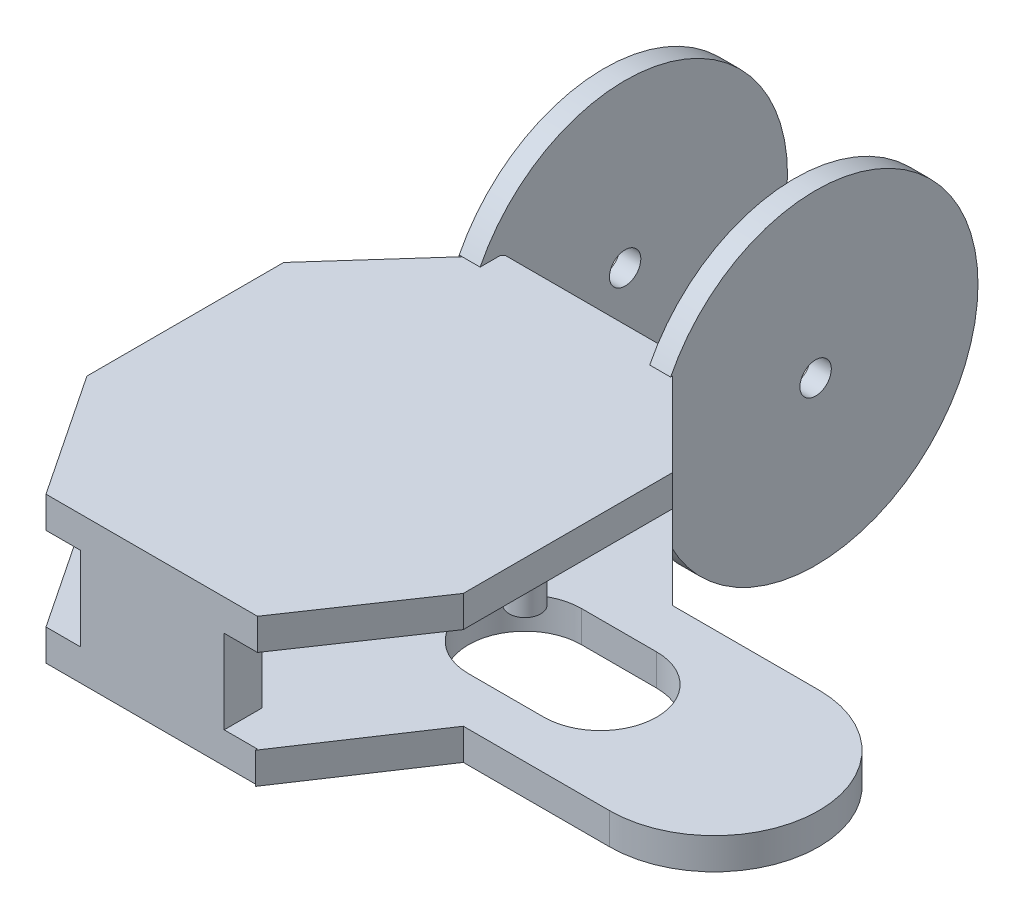
from build123d import *

# Parameters (mm, degrees)
SKETCH1_R            = 1.5
BOSS_EXTRUDE1_DEPTH  = 3
FILLET5_RADIUS       = 10
FILLET5_LENGTH       = 3
FILLET2_R            = 5.4
FILLET4_R            = 5.4
SKETCH2_W            = 20.222728951
SKETCH2_H            = 4.462372077
CUT_EXTRUDE1_DEPTH   = 6
BOSS_EXTRUDE2_START  = 8
BOSS_EXTRUDE2_DEPTH  = 3
SKETCH4_W            = 16.22017041
SKETCH4_H            = 2.049534957
SKETCH4_W_2          = 13.728839959
SKETCH4_H_2          = 3.633925055
BOSS_EXTRUDE3_DEPTH  = 8
BOSS_EXTRUDE4_START  = -8
SKETCH5_R            = 1.5
BOSS_EXTRUDE4_DEPTH  = 8
SKETCH6_R            = 1.5
BOSS_EXTRUDE5_DEPTH  = 8
BOSS_EXTRUDE9_DEPTH  = 2
BOSS_EXTRUDE10_START = 2
SKETCH10_W           = 2.049534957
SKETCH10_H           = 8
BOSS_EXTRUDE10_DEPTH = 2
SKETCH11_R           = 1.5
CUT_EXTRUDE2_DEPTH   = 21


with BuildPart() as part:
    # Sketch1 → Boss-Extrude1 (new body)
    # profile 1 of 2: a face of its own
    with BuildSketch(Plane(origin=(0, 0, 0), x_dir=(1, 0, 0), z_dir=(0, 1, 0))):
        with BuildLine():
            Line((3.5, 25), (0, 25))
            Line((0, 25), (0, 15))
            Line((0, 15), (10, 0))
            Line((10, 0), (26, 0))
            Line((26, 0), (36, 15))
            Line((36, 15), (60, 15))
            Line((60, 15), (60, 25))
            Line((60, 25), (44.5, 25))
            Line((44.5, 25), (44.5, 19.6))
            Line((44.5, 19.6), (26.5, 19.6))
            Line((26.5, 19.6), (26.5, 25))
            Line((26.5, 25), (6.5, 25))
            ThreePointArc((6.5, 25), (5, 23.5), (3.5, 25))
        make_face()
        with Locations(Location((13, 5, 0), (0, 0, 270))):
            Circle(SKETCH1_R, mode=Mode.SUBTRACT)
        with Locations(Location((23, 5, 0), (0, 0, 270))):
            Circle(SKETCH1_R, mode=Mode.SUBTRACT)
    # profile 2 of 2: a face of its own
    with BuildSketch(Plane(origin=(0, 0, 0), x_dir=(1, 0, 0), z_dir=(0, 1, 0))):
        with BuildLine():
            Line((10, 45), (0, 33.819660113))
            Line((0, 33.819660113), (0, 25))
            Line((0, 25), (3.5, 25))
            ThreePointArc((3.5, 25), (5, 26.5), (6.5, 25))
            Line((6.5, 25), (26.5, 25))
            Line((26.5, 25), (26.5, 30.4))
            Line((26.5, 30.4), (44.5, 30.4))
            Line((44.5, 30.4), (44.5, 25))
            Line((44.5, 25), (60, 25))
            Line((60, 25), (60, 35))
            Line((60, 35), (36, 35))
            Line((36, 35), (26, 45))
            Line((26, 45), (10, 45))
        make_face()
    extrude(amount=BOSS_EXTRUDE1_DEPTH)

    # Fillet5: full round fillet: the end face becomes a half cylinder, R = half its width
    fillet5_face = Plane((60, 1.5, -25), x_dir=(0, -1, 0), z_dir=(1, 0, 0))  # on the end face: x along it, z out of the body
    fillet5_slab = fillet5_face.offset(-FILLET5_RADIUS / 2) * Box(FILLET5_LENGTH, 2 * FILLET5_RADIUS, FILLET5_RADIUS, mode=Mode.PRIVATE)  # the body's end, R deep
    fillet5_round = Plane((50, 1.5, -25), x_dir=(1, 0, 0), z_dir=(0, -1, 0)) * Cylinder(FILLET5_RADIUS, FILLET5_LENGTH, mode=Mode.PRIVATE)  # its axis R under the face
    add(fillet5_slab - fillet5_round, mode=Mode.SUBTRACT)

    # Fillet2
    fillet2_edges = [part.edges().sort_by_distance(p)[0] for p in [
        (26.5, 1.5, -30.4),
        (26.5, 1.5, -19.6),
    ]]
    fillet(fillet2_edges, radius=FILLET2_R - 0.0001)  # a hair under: the kernel refuses the full size

    # Fillet4
    fillet4_edges = [part.edges().sort_by_distance(p)[0] for p in [
        (44.5, 1.5, -19.6),
        (44.5, 1.5, -30.4),
    ]]
    fillet(fillet4_edges, radius=FILLET4_R - 0.0001)  # a hair under: the kernel refuses the full size

    # Sketch2 → Cut-Extrude1 (cut)
    with BuildSketch(Plane(origin=(0, 3, 0), x_dir=(1, 0, 0), z_dir=(0, 1, 0))):
        with Locations((17.936134509, 1.031658913)):
            Rectangle(SKETCH2_W, SKETCH2_H)
    extrude(amount=-CUT_EXTRUDE1_DEPTH, mode=Mode.SUBTRACT)



with BuildPart() as body_2:
    # Sketch3 → Boss-Extrude2 (new body)
    with BuildSketch(Plane(origin=(0, 3, 0), x_dir=(1, 0, 0), z_dir=(0, 1, 0)).offset(BOSS_EXTRUDE2_START)):
        Polygon((10, 45), (0, 33.819660113), (0, 15), (7.824770033, 3.262844951), (28.047498984, 3.262844951), (36, 15), (36, 35), (26, 45), align=None)
    extrude(amount=BOSS_EXTRUDE2_DEPTH)


with BuildPart() as part_1:
    add(part.part)

    add(body_2.part)  # Boss-Extrude3 merges body 2
    # Sketch4 → Boss-Extrude3 (add)
    with BuildSketch(Plane(origin=(0, 3, 0), x_dir=(1, 0, 0), z_dir=(0, 1, 0))):
        with Locations((17.889914795, 43.975232522)):
            Rectangle(SKETCH4_W, SKETCH4_H)
        with Locations((18.003368014, 5.079807479)):
            Rectangle(SKETCH4_W_2, SKETCH4_H_2)
    extrude(amount=BOSS_EXTRUDE3_DEPTH)

    # Sketch5 → Boss-Extrude4 (add)
    with BuildSketch(Plane(origin=(0, 14, 0), x_dir=(1, 0, 0), z_dir=(0, 1, 0)).offset(BOSS_EXTRUDE4_START)):
        with Locations(Location((5, 25, 0), (0, 0, 270))):
            Circle(SKETCH5_R)
    extrude(amount=BOSS_EXTRUDE4_DEPTH)

    # Sketch6 → Boss-Extrude5 (add)
    with BuildSketch(Plane(origin=(0, 14, 0), x_dir=(1, 0, 0), z_dir=(0, 1, 0))):
        with Locations(Location((31.9, 25, 0), (0, 0, 270))):
            Circle(SKETCH6_R)
    extrude(amount=-BOSS_EXTRUDE5_DEPTH)

    # Sketch7 → Boss-Extrude9 (add)
    # profile 1 of 2: a face of its own
    with BuildSketch(Plane.ZY.offset(-9.77982959)):
        with BuildLine():
            ThreePointArc((-42.829650223, 14), (-72.227622353, 7), (-42.829650223, 0))
            Line((-42.829650223, 0), (-42.829650223, 14))
        make_face()
        Polygon((-44.753841998, 3), (-45, 3), (-45, 11), (-44.753841998, 11), (-42.950465043, 11), (-42.950465043, 3), align=None, mode=Mode.SUBTRACT)
    # profile 2 of 2: a face of its own
    with BuildSketch(Plane.ZY.offset(-9.77982959)):
        Polygon((-45, 11), (-45, 3), (-44.753841998, 3), (-42.950465043, 3), (-42.950465043, 11), (-44.753841998, 11), align=None)
    extrude(amount=BOSS_EXTRUDE9_DEPTH)

    # Sketch10 → Boss-Extrude10 (add)
    # profile 1 of 2: a face of its own
    with BuildSketch(Plane(origin=(26, 0, 0), x_dir=(0, 0, -1), z_dir=(1, 0, 0)).offset(BOSS_EXTRUDE10_START)):
        with BuildLine():
            ThreePointArc((72.227622353, 7), (60.293097644, 22.109936841), (42.829650223, 14))
            Line((42.829650223, 14), (42.829650223, 0))
            ThreePointArc((42.829650223, 0), (60.293097644, -8.109936841), (72.227622353, 7))
        make_face()
        with Locations((43.975232522, 7)):
            Rectangle(SKETCH10_W, SKETCH10_H, mode=Mode.SUBTRACT)
    # profile 2 of 2: a face of its own
    with BuildSketch(Plane(origin=(26, 0, 0), x_dir=(0, 0, -1), z_dir=(1, 0, 0)).offset(BOSS_EXTRUDE10_START)):
        with Locations((43.975232522, 7)):
            Rectangle(SKETCH10_W, SKETCH10_H)
    extrude(amount=-BOSS_EXTRUDE10_DEPTH)

    # Sketch11 → Cut-Extrude2 (cut)
    with BuildSketch(Plane.ZY.offset(-7.77982959)):
        with Locations((-56.695245471, 7)):
            Circle(SKETCH11_R)
    extrude(amount=-CUT_EXTRUDE2_DEPTH, mode=Mode.SUBTRACT)


solid = part_1.part
